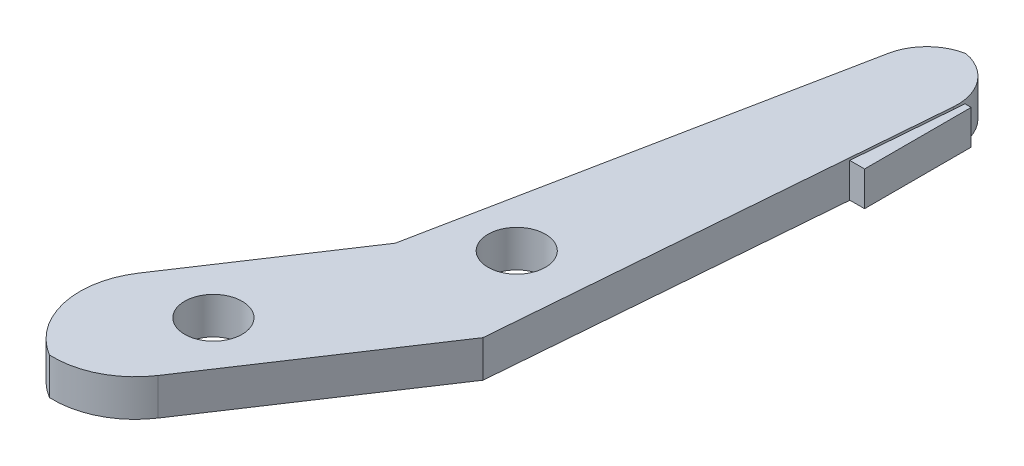
from build123d import *

# Parameters (mm, degrees)
BOSS_EXTRUDE1_DEPTH = 2.25
FILLET1_R           = 5
FILLET2_R           = 3
SKETCH2_R           = 1.75
CUT_EXTRUDE1_DEPTH  = 47.840102946
BOSS_EXTRUDE2_REACH = 40.51
SKETCH4_W           = 6.5
SKETCH4_H           = 2.1
BOSS_EXTRUDE3_REACH = 40.51
SKETCH4_2_W         = 6.5
SKETCH4_2_H         = 2.1


with BuildPart() as part:
    # Sketch1 → Boss-Extrude1 (new body)
    with BuildSketch(Plane(origin=(0, 0, 0), x_dir=(1, 0, 0), z_dir=(0, 1, 0))):
        Polygon((0, 0), (9.957880591, 14.994686196), (15.4441772, 42.451935686), (20.033915457, 42.451935686), (17.6175711, 12.686192897), (7.659690509, -2.308493299), align=None)
    extrude(amount=BOSS_EXTRUDE1_DEPTH)

    # Fillet1
    # the kernel refuses this fillet: 5 mm, written as the material it takes off along each edge
    with BuildSketch(Plane(origin=(7.659690509, -9.280606122, 2.308493299), x_dir=(0.5532155884096079, 0, -0.8330381220212022), z_dir=(0, 1, 0))) as fillet1_piece_1:
        with BuildLine():
            CenterArc((FILLET1_R * 0.742448489754, FILLET1_R), FILLET1_R, 196.816032259, 73.183967741)
            Line((-FILLET1_R * 0.214790094662, FILLET1_R * 0.710700341335), (0, 0))
            Line((0, 0), (FILLET1_R * 0.742448489754, 0))
        make_face()
    extrude(amount=20.811212244, mode=Mode.SUBTRACT)
    with BuildSketch(Plane(origin=(0, -16.83618483, 0), x_dir=(0.5532155884096086, 0, -0.8330381220212018), z_dir=(0, 1, 0))) as fillet1_piece_2:
        with BuildLine():
            CenterArc((FILLET1_R * 1.34689478637, -FILLET1_R), FILLET1_R, 90, 106.816032259)
            Line((FILLET1_R * 0.389656201955, -FILLET1_R * 1.28929965867), (0, 0))
            Line((0, 0), (FILLET1_R * 1.34689478637, 0))
        make_face()
    extrude(amount=35.922369659, mode=Mode.SUBTRACT)

    # Fillet2
    # the kernel refuses this fillet: 3 mm, written as the material it takes off along each edge
    with BuildSketch(Plane(origin=(15.4441772, -6.149660967, -42.451935686), x_dir=(-0.19593916459228597, 0, 0.9806160531925209), z_dir=(0, 1, 0))) as fillet2_piece_1:
        with BuildLine():
            CenterArc((FILLET2_R * 0.819954795549, FILLET2_R), FILLET2_R, 191.29959219, 78.70040781)
            Line((-FILLET2_R * 0.160661257643, FILLET2_R * 0.804060835408), (0, 0))
            Line((0, 0), (FILLET2_R * 0.819954795549, 0))
        make_face()
    extrude(amount=14.549321933, mode=Mode.SUBTRACT)
    with BuildSketch(Plane(origin=(20.033915457, -8.133512114, -42.451935686), x_dir=(-0.08091253350556188, 0, 0.9967212057148735), z_dir=(0, 1, 0))) as fillet2_piece_2:
        with BuildLine():
            CenterArc((FILLET2_R * 1.08446828191, -FILLET2_R), FILLET2_R, 90, 94.641020106)
            Line((FILLET2_R * 0.0877470761958, -FILLET2_R * 1.08091253351), (0, 0))
            Line((0, 0), (FILLET2_R * 1.08446828191, 0))
        make_face()
    extrude(amount=18.517024229, mode=Mode.SUBTRACT)

    # Sketch2 → Cut-Extrude1 (cut, through all)
    with BuildSketch(Plane(origin=(0, 2.25, 0), x_dir=(1, 0, 0), z_dir=(0, 1, 0))):
        with Locations(Location((8.353327454, 5.514543703, 0), (0, 0, 270))):
            Circle(SKETCH2_R)
        with Locations(Location((14.060025472, 18.298658758, 0), (0, 0, 270))):
            Circle(SKETCH2_R)
    extrude(amount=-CUT_EXTRUDE1_DEPTH, mode=Mode.SUBTRACT)

    # Boss-Extrude2: up to this plane
    boss_extrude2_end = Plane(origin=(17.6175711, 2.25, -12.686192897), z_dir=(-0.9967212057148735, 0, -0.0809125335055623))
    # Sketch4 → Boss-Extrude2 (add, up to the surface)
    with BuildSketch(Plane(origin=(20.2, -1.484709168, -8.201879583), x_dir=(0, 0, -1), z_dir=(1, 0, 0)), mode=Mode.PRIVATE) as boss_extrude2_sk1:
        with Locations((28.408493587, 2.541926215)):
            Rectangle(SKETCH4_W, SKETCH4_H)
    boss_extrude2_tool1 = split(extrude(boss_extrude2_sk1.sketch, amount=-BOSS_EXTRUDE2_REACH, mode=Mode.PRIVATE), bisect_by=boss_extrude2_end, keep=Keep.BOTH, mode=Mode.PRIVATE)
    add(boss_extrude2_tool1.solids().sort_by_distance((20.2, 1.057217, -36.610373))[0])

    # Boss-Extrude3: up to this face of the body (flat: up to its plane)
    boss_extrude3_end = Plane(part.part.faces().sort_by_distance((18.476650911, 1.142566407, -23.268769271))[0])
    # Sketch4<2> → Boss-Extrude3 (add, up to the picked face)
    with BuildSketch(Plane(origin=(20.2, -1.484709168, -8.201879583), x_dir=(0, 0, -1), z_dir=(1, 0, 0)), mode=Mode.PRIVATE) as boss_extrude3_sk1:
        with Locations((28.408493587, 2.541926215)):
            Rectangle(SKETCH4_2_W, SKETCH4_2_H)
    boss_extrude3_tool1 = split(extrude(boss_extrude3_sk1.sketch, amount=-BOSS_EXTRUDE3_REACH, mode=Mode.PRIVATE), bisect_by=boss_extrude3_end, keep=Keep.BOTH, mode=Mode.PRIVATE)
    add(boss_extrude3_tool1.solids().sort_by(Axis((20.2, 1.057217, -36.610373), (-1, 0, 0)))[0])


solid = part.part
